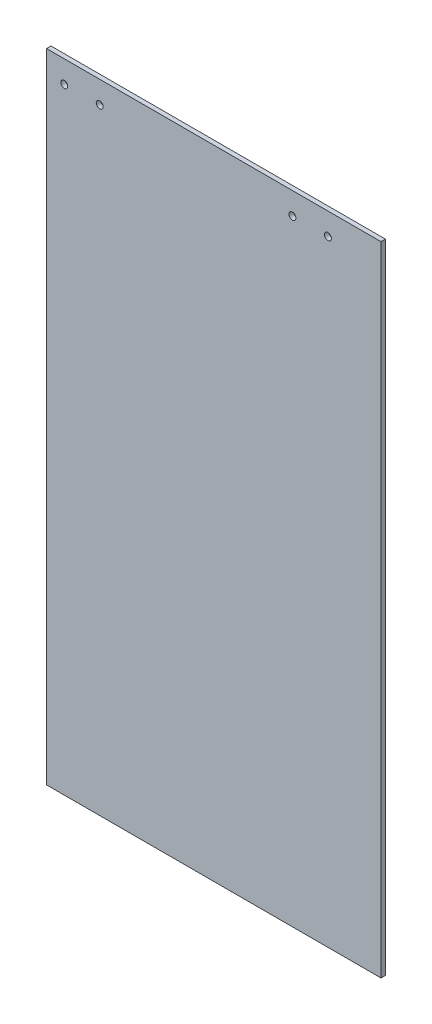
from build123d import *

# Parameters (mm, degrees)
SKETCH1_W                  = 457.2
SKETCH1_H                  = 239.776
BOSS_EXTRUDE1_DEPTH        = 3.175
F_9_0_196_DIAMETER_HOLE2_D = 4.9784


with BuildPart() as part:
    # Sketch1 → Boss-Extrude1 (new body)
    with BuildSketch(Plane(origin=(0, 0, 0), x_dir=(0, 1, 0), z_dir=(0, 0, 1))):
        Rectangle(SKETCH1_W, SKETCH1_H)
    extrude(amount=BOSS_EXTRUDE1_DEPTH)

    # #9 (0.196) Diameter Hole2 (through all)
    with Locations(Plane.XY.offset(3.175)):
        with Locations((-107.188, 212.725), (-81.788, 212.725), (56.388, 212.725), (81.788, 212.725)):
            Hole(F_9_0_196_DIAMETER_HOLE2_D / 2)


solid = part.part
